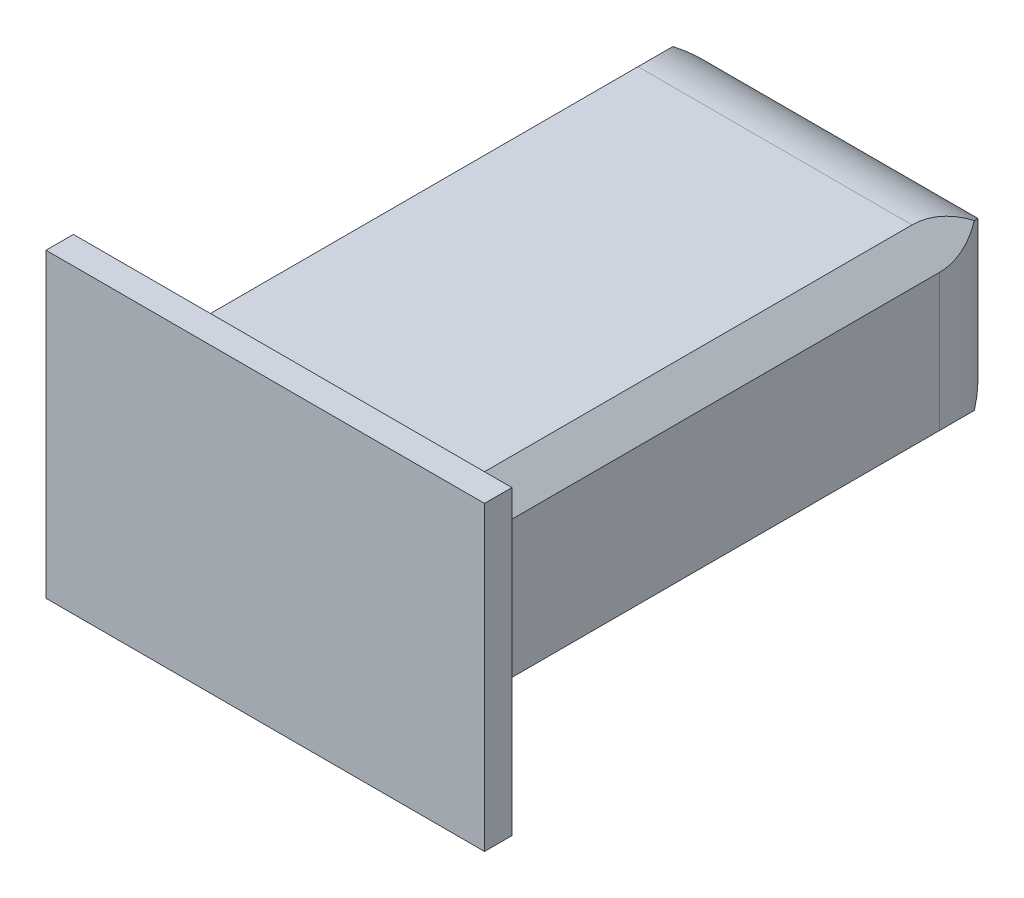
from build123d import *

# Parameters (mm, degrees)
SKETCH1_W           = 3
SKETCH1_H           = 1.75
BOSS_EXTRUDE1_DEPTH = 5
SKETCH2_W           = 4
SKETCH2_H           = 2.75
SKETCH2_W_2         = 3
SKETCH2_H_2         = 1.75
BOSS_EXTRUDE2_DEPTH = 0.5
CHAMFER1_SIZE       = 0.25
FILLET1_R           = 0.85


with BuildPart() as part:
    # Sketch1 → Boss-Extrude1 (new body)
    with BuildSketch(Plane.XY):
        Rectangle(SKETCH1_W, SKETCH1_H)
    extrude(amount=BOSS_EXTRUDE1_DEPTH)

    # Sketch2 → Boss-Extrude2 (add)
    # profile 1 of 2: a face of its own
    with BuildSketch(Plane.XY.offset(5)):
        Rectangle(SKETCH2_W, SKETCH2_H)
        Rectangle(SKETCH2_W_2, SKETCH2_H_2, mode=Mode.SUBTRACT)
    # profile 2 of 2: a face of its own
    with BuildSketch(Plane.XY.offset(5)):
        Rectangle(SKETCH2_W_2, SKETCH2_H_2)
    extrude(amount=BOSS_EXTRUDE2_DEPTH)

    # Chamfer1
    chamfer1_edges = [part.edges().sort_by_distance(p)[0] for p in [
        (0, -1.375, 5),
        (2, 0, 5),
        (0, 1.375, 5),
        (-2, 0, 5),
        (1.5, -0.875, 2.5),
        (-1.5, -0.875, 2.5),
        (-1.5, 0.875, 2.5),
        (1.5, 0.875, 2.5),
    ]]
    chamfer(chamfer1_edges, length=CHAMFER1_SIZE)

    # Fillet1
    # the kernel refuses this fillet: 0.85 mm, written as the material it takes off along each edge
    with BuildSketch(Plane(origin=(-3.375, 0.875, 0), x_dir=(0, 0, 1), z_dir=(1, 0, 0)), Plane(origin=(3.375, -0.875, 0), x_dir=(0, 0, 1), z_dir=(-1, 0, 0))) as fillet1_piece_1:
        with BuildLine():
            CenterArc((FILLET1_R, FILLET1_R), FILLET1_R, 180, 90)
            Line((0, FILLET1_R), (0, 0))
            Line((0, 0), (FILLET1_R, 0))
        make_face()
    extrude(amount=6.75, mode=Mode.SUBTRACT)
    with BuildSketch(Plane(origin=(-1.5, -2.75, 0), x_dir=(0, 0, 1), z_dir=(0, 1, 0)), Plane(origin=(1.5, 2.75, 0), x_dir=(0, 0, 1), z_dir=(0, -1, 0))) as fillet1_piece_2:
        with BuildLine():
            CenterArc((FILLET1_R, FILLET1_R), FILLET1_R, 180, 90)
            Line((0, FILLET1_R), (0, 0))
            Line((0, 0), (FILLET1_R, 0))
        make_face()
    extrude(amount=5.5, mode=Mode.SUBTRACT)


solid = part.part
